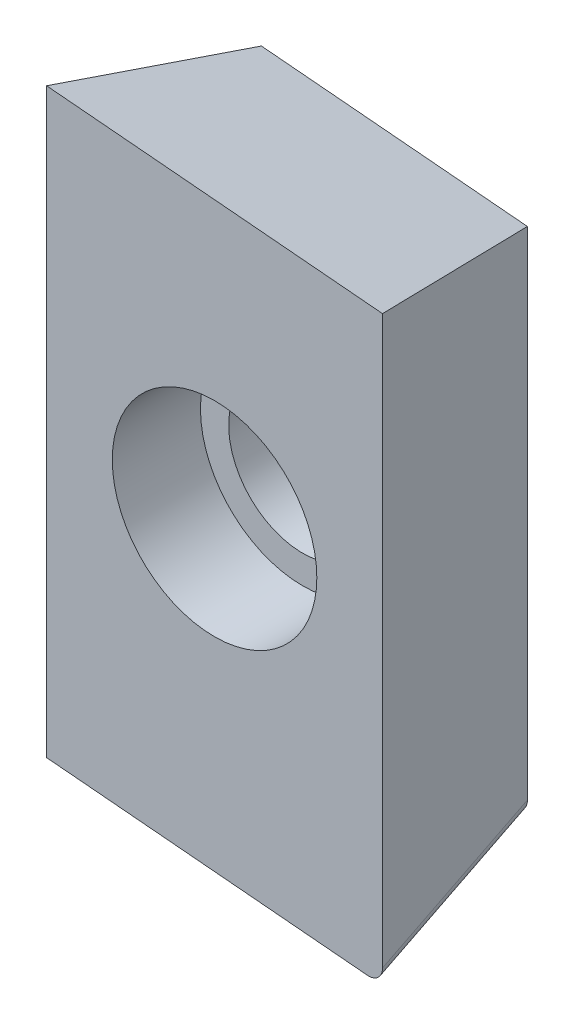
from build123d import *

# Parameters (mm, degrees)
EXTRUDE_1_DEPTH     = 5.1
CUT_EXTRUDE_1_DEPTH = 10
SWEEP_START         = -0.969556918
SWEEP_2_OUTLINE_W   = 12
SWEEP_2_OUTLINE_H   = 9
SWEEP_2_DEPTH       = 0.969556918
SWEEP_START_2       = -16.13744627
SWEEP_3_OUTLINE_W   = 12
SWEEP_3_OUTLINE_H   = 9
SWEEP_3_DEPTH       = 0.969556918
FILLET_2_R          = 0.4
SKETCH_13_R         = 2.9
CUT_EXTRUDE_3_DEPTH = 2.5
SKETCH_14_R         = 2.1
CUT_EXTRUDE_4_DEPTH = 20.917083723


# Read off the part's stored shape, not the designer's step: 切除-扫描2, 切除-扫描3
with BuildPart() as part:
    # 草图1 → 凸台-拉伸1 (new body)
    with BuildSketch(Plane.XY):
        Polygon((0, 0), (9.525, -0.83332952), (9.525, -17.33332952), (0, -16.5), align=None)
    extrude(amount=EXTRUDE_1_DEPTH)

    # 草图4 → 切除-拉伸1 (cut, symmetric)
    with BuildSketch(Plane(origin=(0, -8.25, 0), x_dir=(1, 0, 0), z_dir=(0, 1, 0))):
        Polygon((0, -5.1), (0.991339577, 0), (0, 0), align=None)
        Polygon((9.525, -5.1), (8.533660423, 0), (9.525, 0), align=None)
    extrude(amount=CUT_EXTRUDE_1_DEPTH, both=True, mode=Mode.SUBTRACT)

    # 切除-扫描2 outline → 切除-扫描2 (cut)
    with BuildSketch(Plane(origin=(0, 0, 0), x_dir=(0.9963324805819772, -0.08399418565625866, 0.016326815773634484), z_dir=(0.08556627920719848, 0.9780270466911105, -0.19010919968086795)).offset(SWEEP_START)):
        with Locations((5, -2.5)):
            Rectangle(SWEEP_2_OUTLINE_W, SWEEP_2_OUTLINE_H)
    extrude(amount=SWEEP_2_DEPTH, mode=Mode.SUBTRACT)

    # 切除-扫描3 outline → 切除-扫描3 (cut)
    with BuildSketch(Plane(origin=(0, 0, 0), x_dir=(0.9963324805819772, -0.08399418565625832, -0.016326815773633797), z_dir=(0.08556627920719802, 0.978027046691112, 0.190109199680861)).offset(SWEEP_START_2)):
        with Locations((6, -5.5)):
            Rectangle(SWEEP_3_OUTLINE_W, SWEEP_3_OUTLINE_H)
    extrude(amount=SWEEP_3_DEPTH, mode=Mode.SUBTRACT)

    # 圆角2
    fillet_2_edges = [part.edges().sort_by_distance(p)[0] for p in [
        (9.029330212, -16.794294244, 2.55),
    ]]
    fillet(fillet_2_edges, radius=FILLET_2_R)

    # 草图13 → 切除-拉伸3 (cut)
    with BuildSketch(Plane.XY.offset(5.1)):
        with Locations((4.7625, -8.25)):
            Circle(SKETCH_13_R)
    extrude(amount=-CUT_EXTRUDE_3_DEPTH, mode=Mode.SUBTRACT)

    # 草图14 → 切除-拉伸4 (cut, through all)
    with BuildSketch(Plane.XY.offset(2.6)):
        with Locations((4.7625, -8.25)):
            Circle(SKETCH_14_R)
    extrude(amount=-CUT_EXTRUDE_4_DEPTH, mode=Mode.SUBTRACT)


solid = part.part
